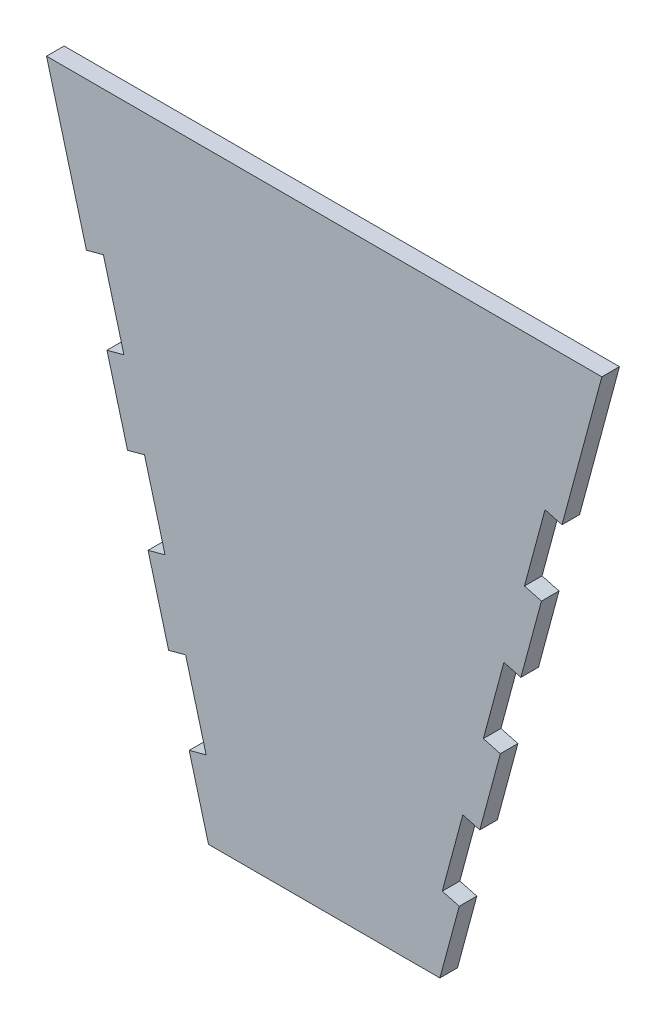
from build123d import *

# Parameters (mm, degrees)
BOSS_EXTRUDE1_DEPTH = 4.826
CUT_EXTRUDE1_DEPTH  = 225.737758901


with BuildPart() as part:
    # Sketch1 → Boss-Extrude1 (new body)
    with BuildSketch(Plane.XY):
        Polygon((152.4, 165.1), (0, 165.1), (44.45, 0), (107.95, 0), align=None)
    extrude(amount=BOSS_EXTRUDE1_DEPTH)

    # Sketch2 → Cut-Extrude1 (cut, through all)
    with BuildSketch(Plane.XY.offset(4.826)):
        Polygon((10.943607233, 124.452315991), (15.603668884, 125.706947974), (21.244365267, 104.755789979), (16.584303617, 103.501157996), align=None)
        Polygon((22.225, 82.55), (26.885061651, 83.804631983), (32.525758034, 62.853473987), (27.865696383, 61.598842004), align=None)
        Polygon((33.506392767, 40.647684009), (38.166454418, 41.902315991), (43.807150801, 20.951157996), (39.14708915, 19.696526013), align=None)
        Polygon((113.25291085, 19.696526013), (118.893607233, 40.647684009), (114.233545582, 41.902315991), (108.592849199, 20.951157996), align=None)
        Polygon((124.534303617, 61.598842004), (130.175, 82.55), (125.514938349, 83.804631983), (119.874241966, 62.853473987), align=None)
        Polygon((135.815696383, 103.501157996), (141.456392767, 124.452315991), (136.796331116, 125.706947974), (131.155634733, 104.755789979), align=None)
    extrude(amount=-CUT_EXTRUDE1_DEPTH, mode=Mode.SUBTRACT)


solid = part.part
